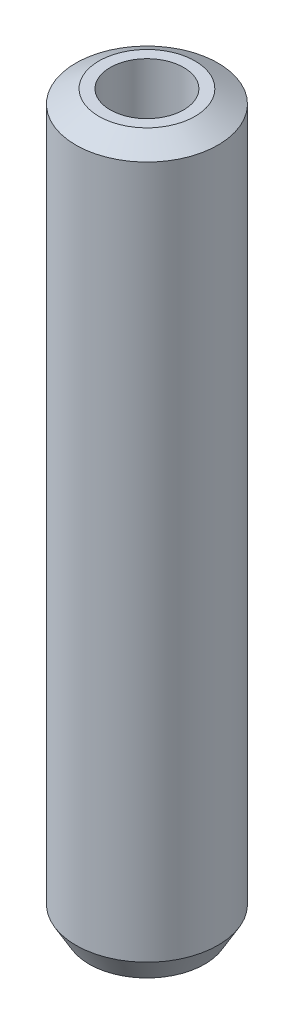
from build123d import *
from OCP.BRepFilletAPI import BRepFilletAPI_MakeChamfer

# Parameters (mm, degrees)
SKETCH1_R           = 22.5
BOSS_EXTRUDE1_DEPTH = 230.808300724
SKETCH2_R           = 11.633076184
CUT_EXTRUDE1_DEPTH  = 233.991355383
CHAMFER1_SIZE       = 4.216179609
CHAMFER1_SIZE2      = 7.302637296


with BuildPart() as part:
    # Sketch1 → Boss-Extrude1 (new body)
    with BuildSketch(Plane(origin=(0, 0, 0), x_dir=(1, 0, 0), z_dir=(0, 1, 0))):
        Circle(SKETCH1_R)
    extrude(amount=BOSS_EXTRUDE1_DEPTH)

    # Sketch2 → Cut-Extrude1 (cut, through all)
    with BuildSketch(Plane(origin=(0, 0, 0), x_dir=(1, 0, 0), z_dir=(0, 1, 0))):
        Circle(SKETCH2_R)
    extrude(amount=CUT_EXTRUDE1_DEPTH, mode=Mode.SUBTRACT)

    # Chamfer1: one chamfer whose edges measure the first distance from different faces: ONE call of the kernel's chamfer builder (chamfer() names one face for all edges)
    chamfer1_edges_1 = [part.edges().sort_by_distance(p)[0] for p in [
        (-22.5, 230.808300724, 0),
    ]]
    chamfer1_side_1 = [part.faces().sort_by_distance(p)[0] for p in [
        (-22.5, 115.404150362, 0),
    ]]
    chamfer1_edges_2 = [part.edges().sort_by_distance(p)[0] for p in [
        (-22.5, 0, 0),
    ]]
    chamfer1_side_2 = [part.faces().sort_by_distance(p)[0] for p in [
        (-21.863603897, 0, 0),
    ]]
    chamfer1 = BRepFilletAPI_MakeChamfer(part.part.solid().wrapped)
    for e in chamfer1_edges_1:
        chamfer1.Add(CHAMFER1_SIZE, CHAMFER1_SIZE2, e.wrapped, chamfer1_side_1[0].wrapped)  # the first distance lies on this face
    for e in chamfer1_edges_2:
        chamfer1.Add(CHAMFER1_SIZE, CHAMFER1_SIZE2, e.wrapped, chamfer1_side_2[0].wrapped)  # the first distance lies on this face
    add(Compound.cast(chamfer1.Shape()), mode=Mode.REPLACE)


solid = part.part
